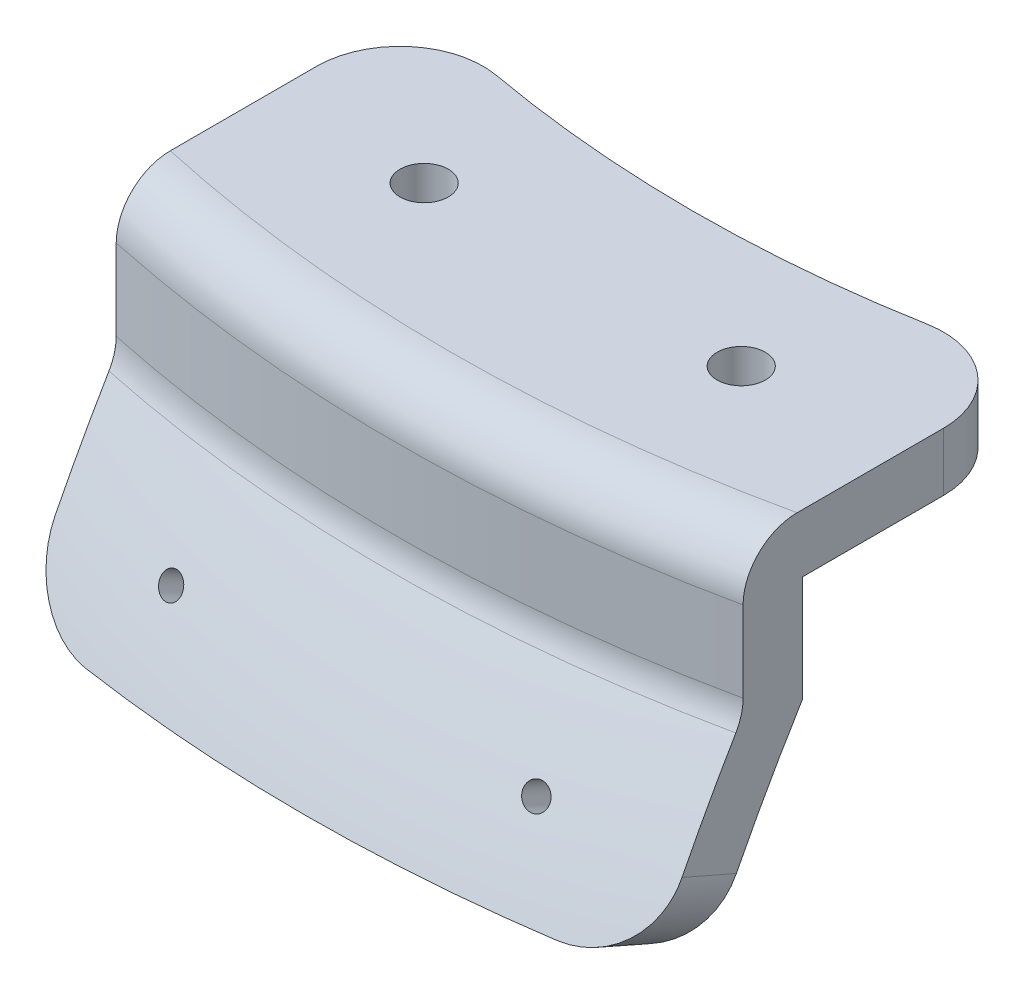
from build123d import *

# Parameters (mm, degrees)
REVOLVE1_ANGLE      = 30
FILLET1_R           = 6.35
SKETCH3_R           = 2.9
CUT_EXTRUDE1_DEPTH  = 204.02156921
SKETCH4_OUTSIDE_W   = 125.474
SKETCH4_OUTSIDE_H   = 77.633
SKETCH4_OUTSIDE_W_2 = 75.329921726
SKETCH4_OUTSIDE_H_2 = 51.667493695
CUT_EXTRUDE2_DEPTH  = 204.02156921
FILLET2_R           = 10


with BuildPart() as part:
    # Sketch2 → Revolve1 (revolve, symmetric)
    with BuildSketch(Plane(origin=(0, 0, 0), x_dir=(0, 0, -1), z_dir=(1, 0, 0))) as revolve1_sk:
        with BuildLine():
            Line((-174.101233777, 209.400503093), (-174.101233777, 196.700503093))
            ThreePointArc((-174.101233777, 196.700503093), (-180.321192386, 185.592119355), (-185.833303485, 174.116026572))
            Line((-185.833303485, 174.116026572), (-192.235041302, 176.94759026))
            ThreePointArc((-192.235041302, 176.94759026), (-186.982593651, 187.948677967), (-181.101233777, 198.626774384))
            Line((-181.101233777, 198.626774384), (-181.101233777, 216.400503093))
            Line((-181.101233777, 216.400503093), (-145.526233777, 216.400503093))
            Line((-145.526233777, 216.400503093), (-145.526233777, 209.400503093))
            Line((-145.526233777, 209.400503093), (-174.101233777, 209.400503093))
        make_face()
    revolve(axis=Axis((0, 91.919777778, 0), (0, 1, 0)), revolution_arc=REVOLVE1_ANGLE / 2)
    revolve(revolve1_sk.sketch, axis=Axis((0, 91.919777778, 0), (0, -1, 0)), revolution_arc=REVOLVE1_ANGLE / 2)

    # Fillet1
    fillet1_edges = [part.edges().sort_by_distance(p)[0] for p in [
        (0, 198.626774384, 181.101233777),
        (0, 216.400503093, 181.101233777),
    ]]
    fillet(fillet1_edges, radius=FILLET1_R)

    # Sketch3 → Cut-Extrude1 (cut, through all)
    with BuildSketch(Plane.XZ.offset(-216.400503093)):
        with Locations((19.05, 158.75)):
            Circle(SKETCH3_R)
        with Locations((-19.05, 158.75)):
            Circle(SKETCH3_R)
    extrude(amount=CUT_EXTRUDE1_DEPTH, mode=Mode.SUBTRACT)

    # Sketch4 outside → Cut-Extrude2 (cut, through all)
    with BuildSketch(Plane(origin=(0, 216.400503093, 0), x_dir=(1, 0, 0), z_dir=(0, 1, 0))):
        with Locations((0, -166.4015)):
            Rectangle(SKETCH4_OUTSIDE_W, SKETCH4_OUTSIDE_H)
        with Locations((0, -166.401294455)):
            Rectangle(SKETCH4_OUTSIDE_W_2, SKETCH4_OUTSIDE_H_2, mode=Mode.SUBTRACT)
    extrude(amount=-CUT_EXTRUDE2_DEPTH, mode=Mode.SUBTRACT)

    # Fillet2
    fillet2_edges = [part.edges().sort_by_distance(p)[0] for p in [
        (-37.664960863, 175.531391116, 185.242847006),
        (-37.664960863, 212.900503093, 140.567547607),
        (37.664960863, 212.900503093, 140.567547607),
        (37.664960863, 175.531391116, 185.242847006),
    ]]
    fillet(fillet2_edges, radius=FILLET2_R)

    # Sketch6 → Cut-Revolve1 (revolve, cut)
    with BuildSketch(Plane(origin=(0, 72.974433775, -37.182331171), x_dir=(0, 0.4539904997395446, 0.891006524188369), z_dir=(0, 0.8910065241883691, -0.45399049973954464))):
        Polygon((217.848132391, 19.059241955), (275.794196508, 24.128865661), (275.663462894, 25.623157708), (217.717398777, 20.553534002), align=None)
    cut_revolve1 = revolve(axis=Axis((19.059241955, 171.875416266, 156.921776072), (0.08715574274765926, 0.45226292882455627, 0.8876159753616077)), mode=Mode.SUBTRACT)

    # Mirror1: Cut-Revolve1 across plane
    add(cut_revolve1.mirror(Plane(origin=(0, 0, 0), x_dir=(0, 0, 1), z_dir=(1, 0, 0))), mode=Mode.SUBTRACT)


solid = part.part
